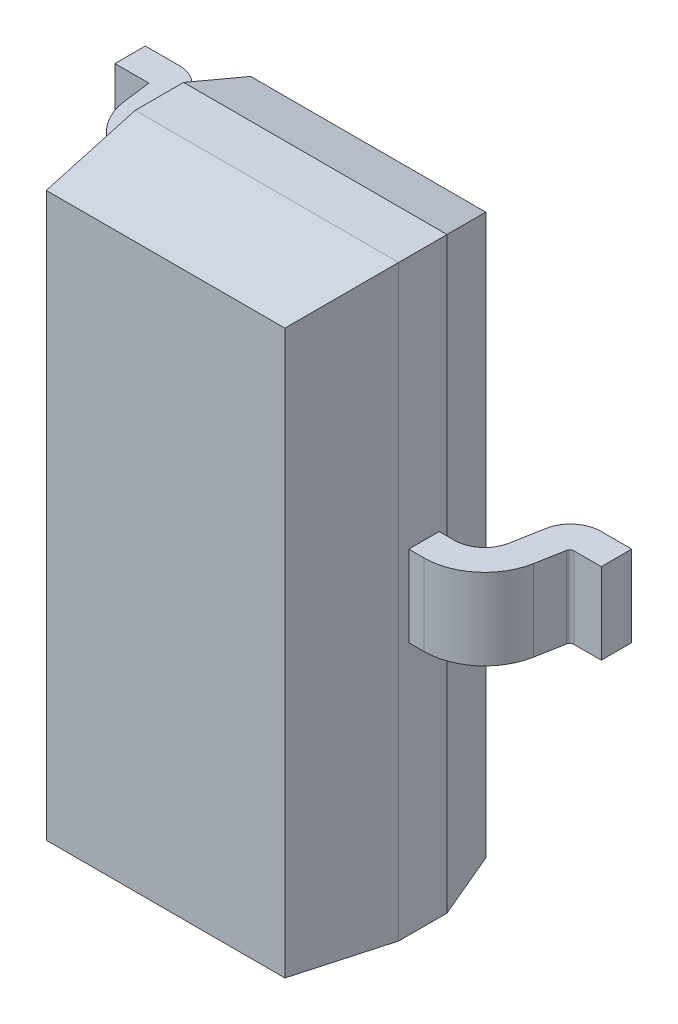
from build123d import *
from OCP.BRepFilletAPI import BRepFilletAPI_MakeChamfer

# Parameters (mm, degrees)
SKETCH_1_W        = 2.9
SKETCH_1_H        = 1.3
EXTRUDE_1_DEPTH   = 1
EXTRUDE_2_DEPTH   = 0.2
EXTRUDE_3_DEPTH   = 0.2
FILLET_1_R        = 0.02
CHAMFER_1_SIZE    = 0.5
CHAMFER_1_SIZE2   = 0.06139228
CHAMFER_2_SIZE    = 0.07
CHAMFER_2_SIZE2   = 0.261243557
MOVE_BODY_1_ANGLE = 120


with BuildPart() as part:
    # Эскиз1 → Бобышка-Вытянуть1 (new body)
    with BuildSketch(Plane(origin=(0, -0.1, 0), x_dir=(-1, 0, 0), z_dir=(0, 1, 0))):
        Rectangle(SKETCH_1_W, SKETCH_1_H)
    extrude(amount=EXTRUDE_1_DEPTH)

    # Эскиз3 → Вытянуть-Тонкостенный2 (add, symmetric)
    with BuildSketch(Plane(origin=(0, 0, 0), x_dir=(0, 0, -1), z_dir=(1, 0, 0))):
        with BuildLine():
            Line((0.65, 0.2), (0.724677848, 0.2))
            ThreePointArc((0.724677848, 0.2), (0.820851333, 0.165111515), (0.872286855, 0.076675477))
            Line((0.872286855, 0.076675477), (0.9, -0.076675477))
            ThreePointArc((0.9, -0.076675477), (0.951435522, -0.165111515), (1.047609007, -0.2))
            Line((1.047609007, -0.2), (1.2, -0.2))
            Line((1.2, -0.2), (1.2, -0.05))
            Line((1.2, -0.05), (1.047609007, -0.05))
            Line((1.047609007, -0.05), (1.019895862, 0.103350954))
            ThreePointArc((1.019895862, 0.103350954), (0.917024818, 0.280223029), (0.724677848, 0.35))
            Line((0.724677848, 0.35), (0.65, 0.35))
            Line((0.65, 0.35), (0.65, 0.2))
        make_face()
    extrude(amount=EXTRUDE_2_DEPTH, both=True)

    # Эскиз4 → Вытянуть-Тонкостенный3 (add, symmetric)
    with BuildSketch(Plane(origin=(0.95, 0, 0), x_dir=(0, 0, -1), z_dir=(1, 0, 0))):
        with BuildLine():
            Line((-0.65, 0.2), (-0.717582667, 0.2))
            ThreePointArc((-0.717582667, 0.2), (-0.816853052, 0.162451726), (-0.866424349, 0.06860521))
            Line((-0.866424349, 0.06860521), (-0.883575651, -0.06860521))
            ThreePointArc((-0.883575651, -0.06860521), (-0.933146948, -0.162451726), (-1.032417333, -0.2))
            Line((-1.032417333, -0.2), (-1.2, -0.2))
            Line((-1.2, -0.2), (-1.2, -0.05))
            Line((-1.2, -0.05), (-1.032417333, -0.05))
            Line((-1.032417333, -0.05), (-1.01526603, 0.08721042))
            ThreePointArc((-1.01526603, 0.08721042), (-0.916123436, 0.274903453), (-0.717582667, 0.35))
            Line((-0.717582667, 0.35), (-0.65, 0.35))
            Line((-0.65, 0.35), (-0.65, 0.2))
        make_face()
    extrude_3 = extrude(amount=EXTRUDE_3_DEPTH, both=True)

    # Скругление1
    fillet_1_edges = [part.edges().sort_by_distance(p)[0] for p in [
        (0, -0.05, -1.047609007),
        (0.95, -0.05, 1.032417333),
    ]]
    fillet(fillet_1_edges, radius=FILLET_1_R)

    # Зеркальное отражение1: Вытянуть-Тонкостенный3 across plane
    add(extrude_3.mirror(Plane(origin=(0, 0, 0), x_dir=(0, 0, 1), z_dir=(1, 0, 0))))

    # Фаска1: one chamfer whose edges measure the first distance from different faces: ONE call of the kernel's chamfer builder (chamfer() names one face for all edges)
    chamfer_1_edges_1 = [part.edges().sort_by_distance(p)[0] for p in [
        (1.45, 0.9, 0),
    ]]
    chamfer_1_side_1 = [part.faces().sort_by_distance(p)[0] for p in [
        (1.45, 0.4, 0),
    ]]
    chamfer_1_edges_2 = [part.edges().sort_by_distance(p)[0] for p in [
        (0, 0.9, -0.65),
    ]]
    chamfer_1_side_2 = [part.faces().sort_by_distance(p)[0] for p in [
        (0, 0.402640845, -0.65),
    ]]
    chamfer_1_edges_3 = [part.edges().sort_by_distance(p)[0] for p in [
        (-1.45, 0.9, 0),
    ]]
    chamfer_1_side_3 = [part.faces().sort_by_distance(p)[0] for p in [
        (-1.45, 0.4, 0),
    ]]
    chamfer_1_edges_4 = [part.edges().sort_by_distance(p)[0] for p in [
        (0, 0.9, 0.65),
    ]]
    chamfer_1_side_4 = [part.faces().sort_by_distance(p)[0] for p in [
        (0, 0.405395683, 0.65),
    ]]
    chamfer_1 = BRepFilletAPI_MakeChamfer(part.part.solid().wrapped)
    for e in chamfer_1_edges_1:
        chamfer_1.Add(CHAMFER_1_SIZE, CHAMFER_1_SIZE2, e.wrapped, chamfer_1_side_1[0].wrapped)  # the first distance lies on this face
    for e in chamfer_1_edges_2:
        chamfer_1.Add(CHAMFER_1_SIZE, CHAMFER_1_SIZE2, e.wrapped, chamfer_1_side_2[0].wrapped)  # the first distance lies on this face
    for e in chamfer_1_edges_3:
        chamfer_1.Add(CHAMFER_1_SIZE, CHAMFER_1_SIZE2, e.wrapped, chamfer_1_side_3[0].wrapped)  # the first distance lies on this face
    for e in chamfer_1_edges_4:
        chamfer_1.Add(CHAMFER_1_SIZE, CHAMFER_1_SIZE2, e.wrapped, chamfer_1_side_4[0].wrapped)  # the first distance lies on this face
    add(Compound.cast(chamfer_1.Shape()), mode=Mode.REPLACE)

    # Фаска2
    chamfer_2_edges = [part.edges().sort_by_distance(p)[0] for p in [
        (0, -0.1, -0.65),
        (1.45, -0.1, 0),
        (0, -0.1, 0.65),
        (-1.45, -0.1, 0),
    ]]
    chamfer_2_side = [part.faces().sort_by_distance(p)[0] for p in [
        (0, -0.1, 0),
    ]]
    chamfer(chamfer_2_edges, length=CHAMFER_2_SIZE, length2=CHAMFER_2_SIZE2, reference=chamfer_2_side[0])


with BuildPart() as part_1:
    # Move Body 1: read off the stored shape, not the designer's step
    # Move Body 1: moved
    add(part.part.moved(Location((0.95, 0.2, -1.115))).rotate(Axis((0, 0, 0), (0.5773502692, -0.5773502692, -0.5773502692)), MOVE_BODY_1_ANGLE))


solid = part_1.part
